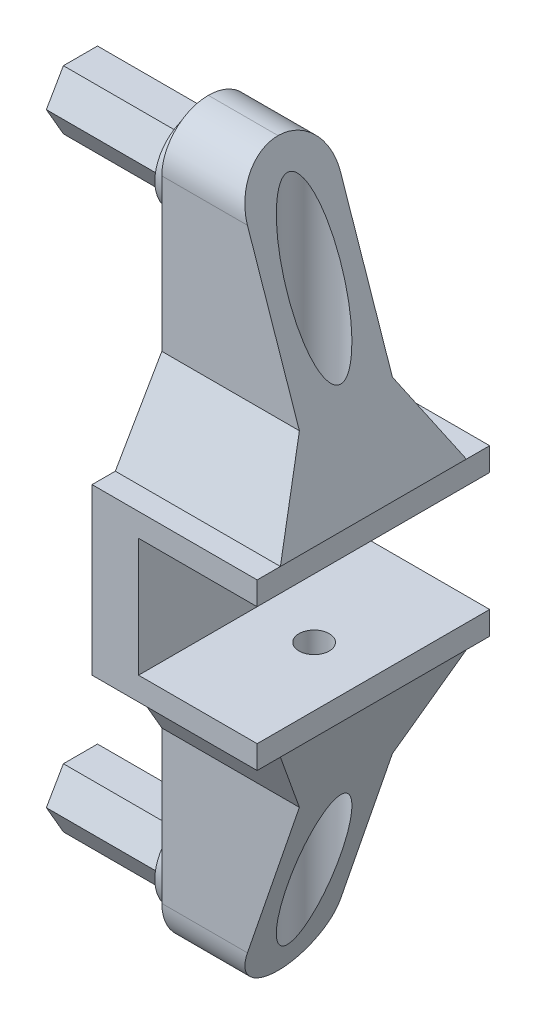
from build123d import *

# Parameters (mm, degrees)
BOSS_EXTRUDE1_DEPTH     = 25
BOSS_EXTRUDE2_DEPTH     = 10
BOSS_EXTRUDE7_DEPTH     = 5
SKETCH4_R               = 9
BOSS_EXTRUDE4_DEPTH     = 2.5
BOSS_EXTRUDE6_DEPTH     = 25
SKETCH7_R               = 2
CUT_EXTRUDE1_DEPTH      = 12
FILLET1_R               = 10
CHAMFER1_SIZE           = 17.320508076
CHAMFER1_SIZE_2         = 10
CUT_EXTRUDE2_DEPTH      = 90.868306427
CUT_EXTRUDE2_DEPTH_BACK = 90.868306427
SKETCH9_R               = 3.25
SKETCH10_R              = 5.75
CUT_EXTRUDE3_DEPTH      = 111.143088753


# Some blends are built 0.0001 mm under size
with BuildPart() as part:
    # Sketch1 → Boss-Extrude1 (new, symmetric)
    with BuildSketch(Plane.XY):
        Polygon((25.5, -12.75), (25.5, -17.75), (-5, -17.75), (-5, 17.75), (25.5, 17.75), (25.5, 12.75), (0, 12.75), (0, -12.75), align=None)
    extrude(amount=BOSS_EXTRUDE1_DEPTH, both=True)

    # Sketch2 → Boss-Extrude2 (add, symmetric)
    with BuildSketch(Plane.XY):
        Polygon((-5, 17.75), (-5, 77.75), (5, 77.75), (25.5, 17.75), align=None)
        Polygon((5, -77.75), (-5, -77.75), (-5, -17.75), (25.5, -17.75), align=None)
    extrude(amount=BOSS_EXTRUDE2_DEPTH, both=True)

    # Sketch8 → Boss-Extrude7 (add)
    with BuildSketch(Plane.ZY.offset(5)):
        Polygon((10, 17.75), (25, 17.75), (25, -17.75), (10, -17.75), (10, -77.75), (-10, -77.75), (-10, -17.75), (-25, -17.75), (-25, 17.75), (-10, 17.75), (-10, 77.75), (10, 77.75), align=None)
    extrude(amount=BOSS_EXTRUDE7_DEPTH)

    # Sketch4 → Boss-Extrude4 (add)
    with BuildSketch(Plane.ZY.offset(10)):
        with Locations((0, 65)):
            Circle(SKETCH4_R)
        with Locations((0, -65)):
            Circle(SKETCH4_R)
    extrude(amount=BOSS_EXTRUDE4_DEPTH)

    # Sketch6 → Boss-Extrude6 (add)
    with BuildSketch(Plane.ZY.offset(12.5)):
        Polygon((7.332348419, 65), (3.666174209, 71.35), (-3.666174209, 71.35), (-7.332348419, 65), (-3.666174209, 58.65), (3.666174209, 58.65), align=None)
        Polygon((7.332348419, -65), (3.666174209, -58.65), (-3.666174209, -58.65), (-7.332348419, -65), (-3.666174209, -71.35), (3.666174209, -71.35), align=None)
    extrude(amount=BOSS_EXTRUDE6_DEPTH)

    # Sketch7 → Cut-Extrude1 (cut)
    with BuildSketch(Plane.ZY.offset(37.5)):
        with Locations((0, 65)):
            Circle(SKETCH7_R)
        with Locations((0, -65)):
            Circle(SKETCH7_R)
    extrude(amount=-CUT_EXTRUDE1_DEPTH, mode=Mode.SUBTRACT)

    # Fillet1
    fillet1_edges = [part.edges().sort_by_distance(p)[0] for p in [
        (-2.5, -77.75, -10),
        (-2.5, -77.75, 10),
        (-2.5, 77.75, -10),
        (-2.5, 77.75, 10),
    ]]
    fillet(fillet1_edges, radius=FILLET1_R - 0.0001)  # a hair under: the kernel refuses the full size

    # Chamfer1
    # the kernel refuses this chamfer: 17.320508076, 10 mm, written as the material it adds along each edge
    with BuildSketch(Plane(origin=(-10, 17.75, -10), x_dir=(0, 0.999813220622208, 0.019326765612700598), z_dir=(1, 0, 0))) as chamfer1_piece_1_section:
        Polygon((CHAMFER1_SIZE * 0.999813220604, -CHAMFER1_SIZE * 0.0193267656124), (-CHAMFER1_SIZE_2 * 0.0193267656127, -CHAMFER1_SIZE_2 * 0.999813220622), (0, 0), align=None)
    chamfer1_piece_1 = extrude(amount=35.5, mode=Mode.PRIVATE)
    chamfer1_piece_1 = split(chamfer1_piece_1, bisect_by=Plane(origin=(21.828322998, 28.496371714, -13.269268631), z_dir=(-0.9462910228001215, -0.32331609945670825, 0)), keep=Keep.TOP, mode=Mode.PRIVATE)
    add(chamfer1_piece_1)
    with BuildSketch(Plane(origin=(25.5, 17.75, 10), x_dir=(0, 0.9998132206222078, -0.019326765612700598), z_dir=(-1, 0, 0))) as chamfer1_piece_2_section:
        Polygon((CHAMFER1_SIZE * 0.999813220604, -CHAMFER1_SIZE * 0.0193267656124), (-CHAMFER1_SIZE_2 * 0.0193267656127, -CHAMFER1_SIZE_2 * 0.999813220622), (0, 0), align=None)
    chamfer1_piece_2 = extrude(amount=35.5, mode=Mode.PRIVATE)
    chamfer1_piece_2 = split(chamfer1_piece_2, bisect_by=Plane(origin=(21.828322998, 28.496371714, 13.269268631), z_dir=(-0.9462910228001215, -0.32331609945670825, 0)), keep=Keep.TOP, mode=Mode.PRIVATE)
    add(chamfer1_piece_2)
    with BuildSketch(Plane(origin=(25.5, -17.75, -10), x_dir=(0, -0.9998132206222078, 0.019326765612700598), z_dir=(-1, 0, 0))) as chamfer1_piece_3_section:
        Polygon((CHAMFER1_SIZE * 0.999813220604, -CHAMFER1_SIZE * 0.0193267656124), (-CHAMFER1_SIZE_2 * 0.0193267656127, -CHAMFER1_SIZE_2 * 0.999813220622), (0, 0), align=None)
    chamfer1_piece_3 = extrude(amount=35.5, mode=Mode.PRIVATE)
    chamfer1_piece_3 = split(chamfer1_piece_3, bisect_by=Plane(origin=(21.828322998, -28.496371714, -13.269268631), z_dir=(-0.9462910228001215, 0.32331609945670825, 0)), keep=Keep.TOP, mode=Mode.PRIVATE)
    add(chamfer1_piece_3)
    with BuildSketch(Plane(origin=(-10, -17.75, 10), x_dir=(0, -0.999813220622208, -0.019326765612700695), z_dir=(1, 0, 0))) as chamfer1_piece_4_section:
        Polygon((CHAMFER1_SIZE * 0.999813220604, -CHAMFER1_SIZE * 0.0193267656124), (-CHAMFER1_SIZE_2 * 0.0193267656127, -CHAMFER1_SIZE_2 * 0.999813220622), (0, 0), align=None)
    chamfer1_piece_4 = extrude(amount=35.5, mode=Mode.PRIVATE)
    chamfer1_piece_4 = split(chamfer1_piece_4, bisect_by=Plane(origin=(21.828322998, -28.496371714, 13.269268631), z_dir=(-0.9462910228001215, 0.32331609945670825, 0)), keep=Keep.TOP, mode=Mode.PRIVATE)
    add(chamfer1_piece_4)

    # Sketch9 → Cut-Extrude2 (cut, two sides: drawn at the far end of the back side and taken through both)
    with BuildSketch(Plane(origin=(0, 0, 0), x_dir=(1, 0, 0), z_dir=(0, 1, 0)).offset(-CUT_EXTRUDE2_DEPTH_BACK)):
        with Locations((12.75, 0)):
            Circle(SKETCH9_R)
    extrude(amount=CUT_EXTRUDE2_DEPTH + CUT_EXTRUDE2_DEPTH_BACK, mode=Mode.SUBTRACT)

    # Sketch10 → Cut-Extrude3 (cut, through all)
    with BuildSketch(Plane(origin=(0, -22.75, 0), x_dir=(1, 0, 0), z_dir=(0, 1, 0))):
        with Locations(Location((12.75, 0, 0), (0, 0, 180))):
            Circle(SKETCH10_R)
    cut_extrude3 = extrude(amount=-CUT_EXTRUDE3_DEPTH, mode=Mode.SUBTRACT)

    # Mirror1: Cut-Extrude3 across plane
    add(cut_extrude3.mirror(Plane.ZX), mode=Mode.SUBTRACT)


solid = part.part
